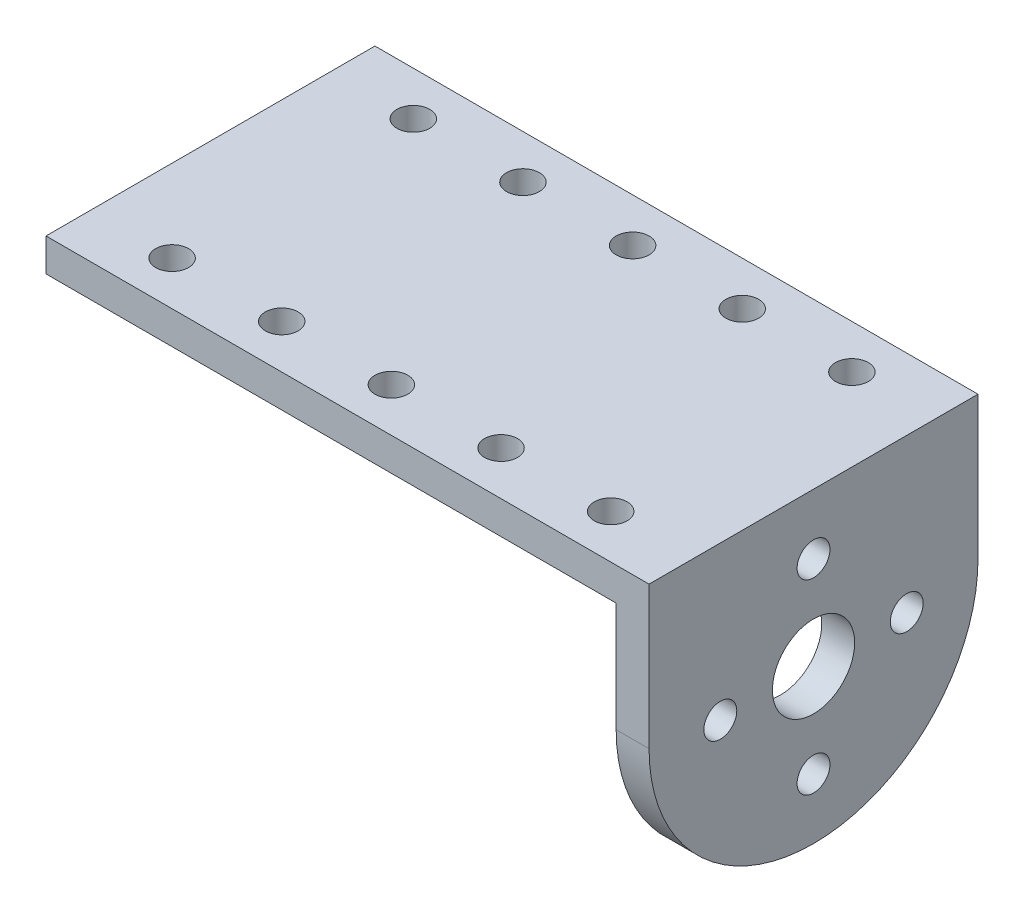
from build123d import *

# Parameters (mm, degrees)
SKETCH1_W           = 55
SKETCH1_H           = 30
SKETCH1_R           = 1.5
BOSS_EXTRUDE1_DEPTH = 3
SKETCH2_W           = 3
SKETCH2_H           = 30
BOSS_EXTRUDE2_DEPTH = 25
SKETCH3_R           = 1.5
SKETCH3_R_2         = 3.75
CUT_EXTRUDE1_DEPTH  = 3
FILLET1_R           = 15


with BuildPart() as part:
    # Sketch1 → Boss-Extrude1 (new body)
    with BuildSketch(Plane(origin=(0, 0, 0), x_dir=(1, 0, 0), z_dir=(0, 1, 0))):
        Rectangle(SKETCH1_W, SKETCH1_H)
        with Locations(Location((20, 11, 0), (0, 0, 270))):
            Circle(SKETCH1_R, mode=Mode.SUBTRACT)
        with Locations(Location((10, 11, 0), (0, 0, 270))):
            Circle(SKETCH1_R, mode=Mode.SUBTRACT)
        with Locations(Location((0, 11, 0), (0, 0, 270))):
            Circle(SKETCH1_R, mode=Mode.SUBTRACT)
        with Locations(Location((-10, 11, 0), (0, 0, 270))):
            Circle(SKETCH1_R, mode=Mode.SUBTRACT)
        with Locations(Location((-20, 11, 0), (0, 0, 270))):
            Circle(SKETCH1_R, mode=Mode.SUBTRACT)
        with Locations(Location((20, -11, 0), (0, 0, 90))):
            Circle(SKETCH1_R, mode=Mode.SUBTRACT)
        with Locations(Location((10, -11, 0), (0, 0, 90))):
            Circle(SKETCH1_R, mode=Mode.SUBTRACT)
        with Locations(Location((0, -11, 0), (0, 0, 90))):
            Circle(SKETCH1_R, mode=Mode.SUBTRACT)
        with Locations(Location((-10, -11, 0), (0, 0, 90))):
            Circle(SKETCH1_R, mode=Mode.SUBTRACT)
        with Locations(Location((-20, -11, 0), (0, 0, 90))):
            Circle(SKETCH1_R, mode=Mode.SUBTRACT)
    extrude(amount=BOSS_EXTRUDE1_DEPTH)

    # Sketch2 → Boss-Extrude2 (add)
    with BuildSketch(Plane.XZ):
        with Locations((26, 0)):
            Rectangle(SKETCH2_W, SKETCH2_H)
    extrude(amount=BOSS_EXTRUDE2_DEPTH)

    # Sketch3 → Cut-Extrude1 (cut)
    with BuildSketch(Plane(origin=(27.5, 0, 0), x_dir=(0, 0, -1), z_dir=(1, 0, 0))):
        with Locations((0, -19.5)):
            Circle(SKETCH3_R)
        with Locations((-8.5, -11)):
            Circle(SKETCH3_R)
        with Locations((0, -2.5)):
            Circle(SKETCH3_R)
        with Locations((8.5, -11)):
            Circle(SKETCH3_R)
        with Locations((0, -11)):
            Circle(SKETCH3_R_2)
    extrude(amount=-CUT_EXTRUDE1_DEPTH, mode=Mode.SUBTRACT)

    # Fillet1
    fillet1_edges = [part.edges().sort_by_distance(p)[0] for p in [
        (26, -25, -15),
        (26, -25, 15),
    ]]
    fillet(fillet1_edges, radius=FILLET1_R - 0.0001)  # a hair under: the kernel refuses the full size


solid = part.part
